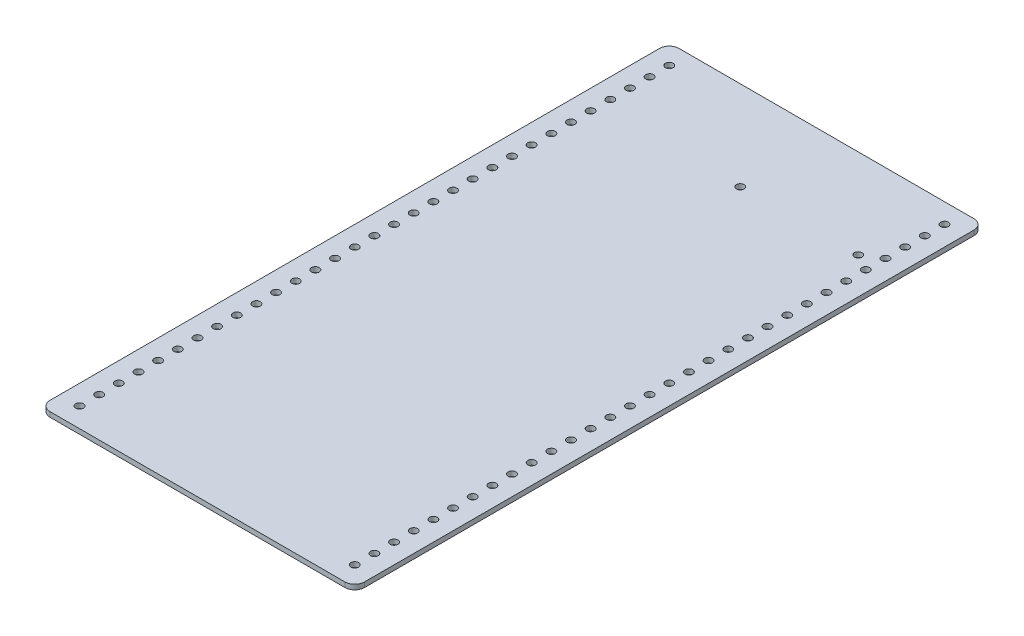
from build123d import *

# Parameters (mm, degrees)
BOSS_EXTRUDE1_DEPTH = 3.175
SKETCH3_R           = 2.5
CUT_EXTRUDE2_DEPTH  = 312.626023698
SKETCH7_R           = 2.5
CUT_EXTRUDE5_DEPTH  = 312.626023698


with BuildPart() as part:
    # Sketch1 → Boss-Extrude1 (new body)
    with BuildSketch(Plane(origin=(0, 0, 0), x_dir=(1, 0, 0), z_dir=(0, 1, 0))):
        with BuildLine():
            Line((-77.88977591, 288.008963585), (112.61022409, 288.008963585))
            ThreePointArc((112.61022409, 288.008963585), (117.10035215, 286.149091646), (118.96022409, 281.658963585))
            Line((118.96022409, 281.658963585), (118.96022409, -112.041036415))
            ThreePointArc((118.96022409, -112.041036415), (117.10035215, -116.531164475), (112.61022409, -118.391036415))
            Line((112.61022409, -118.391036415), (-77.88977591, -118.391036415))
            ThreePointArc((-77.88977591, -118.391036415), (-82.379903971, -116.531164475), (-84.23977591, -112.041036415))
            Line((-84.23977591, -112.041036415), (-84.23977591, 281.658963585))
            ThreePointArc((-84.23977591, 281.658963585), (-82.379903971, 286.149091646), (-77.88977591, 288.008963585))
        make_face()
    extrude(amount=BOSS_EXTRUDE1_DEPTH)

    # Sketch3 → Cut-Extrude2 (cut, through all)
    with BuildSketch(Plane(origin=(0, 3.175, 0), x_dir=(1, 0, 0), z_dir=(0, 1, 0))):
        with Locations((-71.53977591, 275.308963585)):
            Circle(SKETCH3_R)
        with Locations((106.26022409, 275.308963585)):
            Circle(SKETCH3_R)
        with Locations((-71.53977591, 262.608963585)):
            Circle(SKETCH3_R)
        with Locations((106.26022409, 262.608963585)):
            Circle(SKETCH3_R)
        with Locations((-71.53977591, 249.908963585)):
            Circle(SKETCH3_R)
        with Locations((106.26022409, 249.908963585)):
            Circle(SKETCH3_R)
        with Locations((-71.53977591, 237.208963585)):
            Circle(SKETCH3_R)
        with Locations((106.26022409, 237.208963585)):
            Circle(SKETCH3_R)
        with Locations((-71.53977591, 224.508963585)):
            Circle(SKETCH3_R)
        with Locations((106.26022409, 224.508963585)):
            Circle(SKETCH3_R)
        with Locations((-71.53977591, 211.808963585)):
            Circle(SKETCH3_R)
        with Locations((106.26022409, 211.808963585)):
            Circle(SKETCH3_R)
        with Locations((-71.53977591, 199.108963585)):
            Circle(SKETCH3_R)
        with Locations((106.26022409, 199.108963585)):
            Circle(SKETCH3_R)
        with Locations((-71.53977591, 186.408963585)):
            Circle(SKETCH3_R)
        with Locations((106.26022409, 186.408963585)):
            Circle(SKETCH3_R)
        with Locations((-71.53977591, 173.708963585)):
            Circle(SKETCH3_R)
        with Locations((106.26022409, 173.708963585)):
            Circle(SKETCH3_R)
        with Locations((-71.53977591, 161.008963585)):
            Circle(SKETCH3_R)
        with Locations((106.26022409, 161.008963585)):
            Circle(SKETCH3_R)
        with Locations((-71.53977591, 148.308963585)):
            Circle(SKETCH3_R)
        with Locations((106.26022409, 148.308963585)):
            Circle(SKETCH3_R)
        with Locations((-71.53977591, 135.608963585)):
            Circle(SKETCH3_R)
        with Locations((106.26022409, 135.608963585)):
            Circle(SKETCH3_R)
        with Locations((-71.53977591, 122.908963585)):
            Circle(SKETCH3_R)
        with Locations((106.26022409, 122.908963585)):
            Circle(SKETCH3_R)
        with Locations((-71.53977591, 110.208963585)):
            Circle(SKETCH3_R)
        with Locations((106.26022409, 110.208963585)):
            Circle(SKETCH3_R)
        with Locations((-71.53977591, 97.508963585)):
            Circle(SKETCH3_R)
        with Locations((106.26022409, 97.508963585)):
            Circle(SKETCH3_R)
        with Locations((-71.53977591, 84.808963585)):
            Circle(SKETCH3_R)
        with Locations((106.26022409, 84.808963585)):
            Circle(SKETCH3_R)
        with Locations((-71.53977591, 72.108963585)):
            Circle(SKETCH3_R)
        with Locations((106.26022409, 72.108963585)):
            Circle(SKETCH3_R)
        with Locations((-71.53977591, 59.408963585)):
            Circle(SKETCH3_R)
        with Locations((106.26022409, 59.408963585)):
            Circle(SKETCH3_R)
        with Locations((-71.53977591, 46.708963585)):
            Circle(SKETCH3_R)
        with Locations((106.26022409, 46.708963585)):
            Circle(SKETCH3_R)
        with Locations((-71.53977591, 34.008963585)):
            Circle(SKETCH3_R)
        with Locations((106.26022409, 34.008963585)):
            Circle(SKETCH3_R)
        with Locations((-71.53977591, 21.308963585)):
            Circle(SKETCH3_R)
        with Locations((106.26022409, 21.308963585)):
            Circle(SKETCH3_R)
        with Locations((-71.53977591, 8.608963585)):
            Circle(SKETCH3_R)
        with Locations((106.26022409, 8.608963585)):
            Circle(SKETCH3_R)
        with Locations((-71.53977591, -4.091036415)):
            Circle(SKETCH3_R)
        with Locations((106.26022409, -4.091036415)):
            Circle(SKETCH3_R)
        with Locations((-71.53977591, -16.791036415)):
            Circle(SKETCH3_R)
        with Locations((106.26022409, -16.791036415)):
            Circle(SKETCH3_R)
        with Locations((-71.53977591, -29.491036415)):
            Circle(SKETCH3_R)
        with Locations((106.26022409, -29.491036415)):
            Circle(SKETCH3_R)
        with Locations((-71.53977591, -42.191036415)):
            Circle(SKETCH3_R)
        with Locations((106.26022409, -42.191036415)):
            Circle(SKETCH3_R)
        with Locations((-71.53977591, -54.891036415)):
            Circle(SKETCH3_R)
        with Locations((106.26022409, -54.891036415)):
            Circle(SKETCH3_R)
        with Locations((-71.53977591, -67.591036415)):
            Circle(SKETCH3_R)
        with Locations((106.26022409, -67.591036415)):
            Circle(SKETCH3_R)
        with Locations((-71.53977591, -80.291036415)):
            Circle(SKETCH3_R)
        with Locations((106.26022409, -80.291036415)):
            Circle(SKETCH3_R)
        with Locations((-71.53977591, -92.991036415)):
            Circle(SKETCH3_R)
        with Locations((106.26022409, -92.991036415)):
            Circle(SKETCH3_R)
        with Locations((-71.53977591, -105.691036415)):
            Circle(SKETCH3_R)
        with Locations((106.26022409, -105.691036415)):
            Circle(SKETCH3_R)
    extrude(amount=-CUT_EXTRUDE2_DEPTH, mode=Mode.SUBTRACT)

    # Sketch7 → Cut-Extrude5 (cut, through all)
    with BuildSketch(Plane(origin=(0, 3.175, 0), x_dir=(1, 0, 0), z_dir=(0, 1, 0))):
        with Locations((95.479619174, 230.367748104)):
            Circle(SKETCH7_R)
        with Locations((19.279619174, 230.367748104)):
            Circle(SKETCH7_R)
    extrude(amount=-CUT_EXTRUDE5_DEPTH, mode=Mode.SUBTRACT)


solid = part.part
